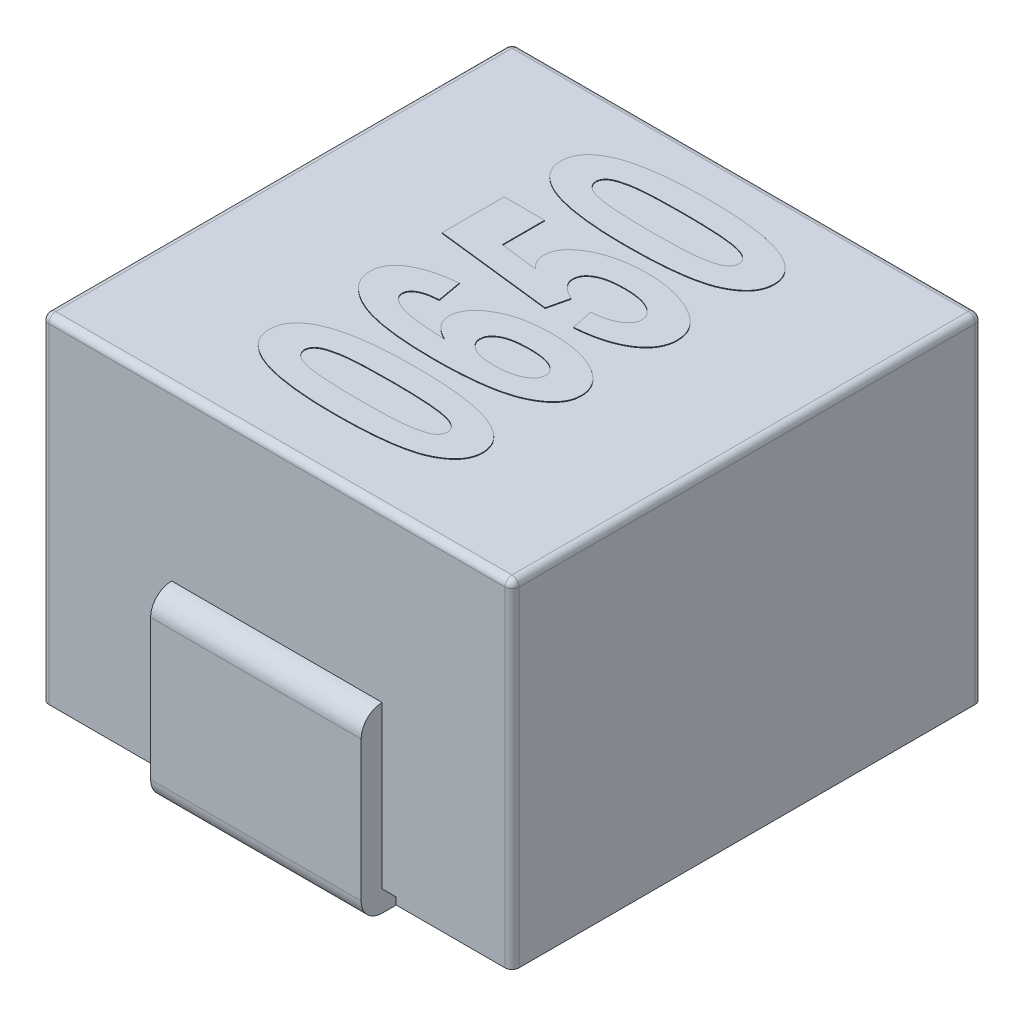
from build123d import *

# Parameters (mm, degrees)
EXTRUDE_1_DEPTH     = 4.8
SKETCH_2_W          = 3.4
SKETCH_2_H          = 2
CUT_EXTRUDE_1_DEPTH = 0.1
EXTRUDE_START       = -1.5
EXTRUDE_1_2_DEPTH   = 3
EXTRUDE_2_DEPTH     = 3
FILLET_1_R          = 0.1
EXTRUDE_2_2_DEPTH   = 0.01


# Read off the part's stored shape, not the designer's step: Вытянуть-Тонкостенный1, Вытянуть-Тонкостенный2
with BuildPart() as part:
    # Эскиз1 → Extrude 1 (new body)
    with BuildSketch(Plane(origin=(0, 0, 0), x_dir=(1, 0, 0), z_dir=(0, 1, 0))):
        with BuildLine():
            Line((-3.25, -3.35), (3.25, -3.35))
            ThreePointArc((3.25, -3.35), (3.320710678, -3.320710678), (3.35, -3.25))
            Line((3.35, -3.25), (3.35, 3.25))
            ThreePointArc((3.35, 3.25), (3.320710678, 3.320710678), (3.25, 3.35))
            Line((3.25, 3.35), (-3.25, 3.35))
            ThreePointArc((-3.25, 3.35), (-3.320710678, 3.320710678), (-3.35, 3.25))
            Line((-3.35, 3.25), (-3.35, -3.25))
            ThreePointArc((-3.35, -3.25), (-3.320710678, -3.320710678), (-3.25, -3.35))
        make_face()
    extrude(amount=EXTRUDE_1_DEPTH)

    # Эскиз2 → Вырез-Вытянуть1 (cut)
    with BuildSketch(Plane.XZ):
        with Locations((0, 2.35)):
            Rectangle(SKETCH_2_W, SKETCH_2_H)
        with Locations((0, -2.35)):
            Rectangle(SKETCH_2_W, SKETCH_2_H)
    extrude(amount=-CUT_EXTRUDE_1_DEPTH, mode=Mode.SUBTRACT)

    # Extrude 1 2 outline → Extrude 1 2 (add)
    with BuildSketch(Plane(origin=(0, 0, 0), x_dir=(0, 0, -1), z_dir=(1, 0, 0)).offset(EXTRUDE_START)):
        with BuildLine():
            Line((-3.35, -0.2), (-1.85, -0.2))
            Line((-1.85, -0.2), (-1.85, 0.1))
            Line((-1.85, 0.1), (-3.35, 0.1))
            Line((-3.35, 0.1), (-3.35, 2.4))
            ThreePointArc((-3.35, 2.4), (-3.562132034, 2.312132034), (-3.65, 2.1))
            Line((-3.65, 2.1), (-3.65, 0.1))
            ThreePointArc((-3.65, 0.1), (-3.562132034, -0.112132034), (-3.35, -0.2))
        make_face()
    extrude(amount=EXTRUDE_1_2_DEPTH)

    # Extrude 2 outline → Extrude 2 (add)
    with BuildSketch(Plane(origin=(0, 0, 0), x_dir=(0, 0, -1), z_dir=(1, 0, 0)).offset(EXTRUDE_START)):
        with BuildLine():
            Line((1.85, 0.1), (1.85, -0.2))
            Line((1.85, -0.2), (3.35, -0.2))
            ThreePointArc((3.35, -0.2), (3.562132034, -0.112132034), (3.65, 0.1))
            Line((3.65, 0.1), (3.65, 2.1))
            ThreePointArc((3.65, 2.1), (3.562132034, 2.312132034), (3.35, 2.4))
            Line((3.35, 2.4), (3.35, 0.1))
            Line((3.35, 0.1), (1.85, 0.1))
        make_face()
    extrude(amount=EXTRUDE_2_DEPTH)

    # Скругление1
    fillet_1_edges = [part.edges().sort_by_distance(p)[0] for p in [
        (3.320710678, 4.8, 3.320710678),
        (3.35, 4.8, 0),
        (3.320710678, 4.8, -3.320710678),
        (0, 4.8, -3.35),
        (-3.320710678, 4.8, -3.320710678),
        (-3.35, 4.8, 0),
        (-3.320710678, 4.8, 3.320710678),
        (0, 4.8, 3.35),
    ]]
    fillet(fillet_1_edges, radius=FILLET_1_R)

    # Эскиз4 → Extrude 2 2 (add)
    # profile 1 of 4: a face of its own
    with BuildSketch(Plane(origin=(0, 4.8, 0), x_dir=(1, 0, 0), z_dir=(0, 1, 0))):
        with BuildLine():
            add(Edge.make_bspline(
                [(-1.5, -1.957692308), (-1.499137143, -1.936566876), (-1.497447551, -1.895200382), (-1.482242122, -1.835098379), (-1.458087806, -1.778584119), (-1.423755807, -1.725761979), (-1.379856182, -1.676448664), (-1.325522016, -1.631842814), (-1.26298141, -1.589080556), (-1.216074382, -1.565892222), (-1.191706731, -1.553846154)],
                knots=[0, 0, 0, 0, 0.939629869, 1.83992419, 2.743264454, 3.666481804, 4.633505536, 5.672028627, 6.790646185, 8, 8, 8, 8], degree=3))
            add(Edge.make_bspline(
                [(-1.191706731, -1.553846154), (-1.158904384, -1.53955104), (-1.089763949, -1.509419953), (-0.974752135, -1.475847916), (-0.845845006, -1.445625948), (-0.701374134, -1.422391671), (-0.542246126, -1.402919805), (-0.367938846, -1.39061196), (-0.178780437, -1.381621929), (-0.047688732, -1.381060813), (0.020432692, -1.380769231)],
                knots=[0, 0, 0, 0, 0.695993191, 1.467006985, 2.327867947, 3.272915826, 4.313905632, 5.448135814, 6.673931191, 8, 8, 8, 8], degree=3))
            add(Edge.make_bspline(
                [(0.020432692, -1.380769231), (0.088346822, -1.38142732), (0.219213706, -1.382695421), (0.408266166, -1.390058637), (0.582217851, -1.404033081), (0.741553906, -1.421993189), (0.886013143, -1.446535154), (1.015745714, -1.476191084), (1.131109184, -1.510782717), (1.200752724, -1.540810484), (1.233774038, -1.555048077)],
                knots=[0, 0, 0, 0, 1.320779415, 2.545071084, 3.678366063, 4.713891943, 5.66240021, 6.526117529, 7.301162213, 8, 8, 8, 8], degree=3))
            add(Edge.make_bspline(
                [(1.233774038, -1.555048077), (1.257897503, -1.567159433), (1.304232457, -1.590422224), (1.366586207, -1.632149894), (1.419375705, -1.677271606), (1.462958308, -1.725975571), (1.497291664, -1.778447599), (1.520545201, -1.835248332), (1.53595582, -1.895181056), (1.537614479, -1.936560343), (1.538461538, -1.957692308)],
                knots=[0, 0, 0, 0, 1.209008214, 2.322193053, 3.353572777, 4.313995313, 5.243012364, 6.148517307, 7.054467326, 8, 8, 8, 8], degree=3))
            add(Edge.make_bspline(
                [(1.538461538, -1.957692308), (1.537411817, -1.978827802), (1.535332896, -2.02068559), (1.518925325, -2.081659932), (1.492824036, -2.139688165), (1.455493603, -2.194066787), (1.407742305, -2.245076498), (1.349426407, -2.292430364), (1.280976264, -2.336770497), (1.20193948, -2.378856542), (1.109155229, -2.416617895), (1.000326036, -2.447366483), (0.875989924, -2.475078094), (0.73501802, -2.496736352), (0.57803189, -2.514064356), (0.404573204, -2.525324635), (0.215024127, -2.533630888), (0.083143563, -2.534278123), (0.014423077, -2.534615385)],
                knots=[0, 0, 0, 0, 0.570946305, 1.130730606, 1.695682016, 2.284720325, 2.905752519, 3.57931678, 4.311109974, 5.108472247, 5.997836566, 7.014420583, 8.163245194, 9.441390503, 10.869501499, 12.433562194, 14.141596213, 16, 16, 16, 16], degree=3))
            add(Edge.make_bspline(
                [(0.014423077, -2.534615385), (-0.053091481, -2.533963284), (-0.183359594, -2.532705068), (-0.371596935, -2.525242226), (-0.545219308, -2.51161966), (-0.703981404, -2.492416926), (-0.848231491, -2.469095664), (-0.97745489, -2.439051032), (-1.092651154, -2.404620183), (-1.162292314, -2.374580012), (-1.1953125, -2.360336538)],
                knots=[0, 0, 0, 0, 1.316839064, 2.540817049, 3.673540427, 4.712565747, 5.659351526, 6.521795573, 7.299112968, 8, 8, 8, 8], degree=3))
            add(Edge.make_bspline(
                [(-1.1953125, -2.360336538), (-1.219440057, -2.348228581), (-1.265782873, -2.324972317), (-1.32808256, -2.283199756), (-1.381170251, -2.238132726), (-1.424095116, -2.188901849), (-1.459027623, -2.136872971), (-1.482048346, -2.080111905), (-1.497503564, -2.020209967), (-1.499156079, -1.978826439), (-1.5, -1.957692308)],
                knots=[0, 0, 0, 0, 1.209129629, 2.322426261, 3.353909562, 4.321163245, 5.242735491, 6.14833137, 7.05437237, 8, 8, 8, 8], degree=3))
        make_face()
        with BuildLine():
            add(Edge.make_bspline(
                [(-1, -1.957692308), (-0.999127679, -1.968216797), (-0.997360051, -1.989543107), (-0.98464763, -2.020189646), (-0.963752812, -2.048548502), (-0.934793713, -2.075564705), (-0.894910908, -2.09990752), (-0.842840464, -2.120448699), (-0.778433667, -2.137921563), (-0.731044768, -2.146944568), (-0.705528846, -2.151802885)],
                knots=[0, 0, 0, 0, 0.66053735, 1.338480494, 2.051183008, 2.861689582, 3.811811342, 4.969049189, 6.368024884, 8, 8, 8, 8], degree=3))
            add(Edge.make_bspline(
                [(-0.705528846, -2.151802885), (-0.686111734, -2.154704884), (-0.644159002, -2.160974962), (-0.576454743, -2.168853117), (-0.499229717, -2.1742951), (-0.413125803, -2.180127901), (-0.317716076, -2.183163637), (-0.213360006, -2.186421571), (-0.099564736, -2.188131724), (-0.020633397, -2.188348668), (0.020432692, -2.188461538)],
                knots=[0, 0, 0, 0, 0.647628605, 1.399270384, 2.247685976, 3.201110699, 4.24594481, 5.39623077, 6.6453211, 8, 8, 8, 8], degree=3))
            add(Edge.make_bspline(
                [(0.020432692, -2.188461538), (0.061297689, -2.188275136), (0.13962396, -2.187917856), (0.252024839, -2.187185067), (0.354384455, -2.183885271), (0.446927652, -2.18023517), (0.529543314, -2.176665945), (0.602017058, -2.17022466), (0.664624604, -2.164110466), (0.732465088, -2.153898049), (0.803572683, -2.140125262), (0.875380999, -2.120604957), (0.93178471, -2.099804879), (0.973513657, -2.07550215), (1.002243275, -2.048087616), (1.023951014, -2.020532594), (1.035633028, -1.989383166), (1.037524767, -1.968187963), (1.038461538, -1.957692308)],
                knots=[0, 0, 0, 0, 1.772229522, 3.396846643, 4.874325468, 6.213183949, 7.413572011, 8.459660885, 9.368179202, 10.14095794, 11.434081607, 12.506883432, 13.365124891, 14.035567992, 14.582591736, 15.079517174, 15.544185971, 16, 16, 16, 16], degree=3))
            add(Edge.make_bspline(
                [(1.038461538, -1.957692308), (1.037650183, -1.946944638), (1.036035603, -1.925557014), (1.022740293, -1.895014588), (1.002646122, -1.866265058), (0.972969063, -1.83991199), (0.933432472, -1.815419158), (0.881280735, -1.794956445), (0.816902053, -1.777456443), (0.769508703, -1.768437735), (0.743990385, -1.763581731)],
                knots=[0, 0, 0, 0, 0.672803919, 1.338864841, 2.061605897, 2.863308736, 3.813131099, 4.970004284, 6.368539142, 8, 8, 8, 8], degree=3))
            add(Edge.make_bspline(
                [(0.743990385, -1.763581731), (0.724572687, -1.760684675), (0.682815507, -1.754454644), (0.615519911, -1.746519364), (0.538893118, -1.741091016), (0.453191294, -1.735236285), (0.357980214, -1.732225337), (0.253624515, -1.728961702), (0.140029441, -1.727256369), (0.061298449, -1.727036962), (0.020432692, -1.726923077)],
                knots=[0, 0, 0, 0, 0.649769229, 1.397309303, 2.24191953, 3.191878681, 4.240166309, 5.394254338, 6.647473319, 8, 8, 8, 8], degree=3))
            add(Edge.make_bspline(
                [(0.020432692, -1.726923077), (-0.020432322, -1.727108707), (-0.098758626, -1.727464505), (-0.211359517, -1.728208719), (-0.313919908, -1.731488821), (-0.40666384, -1.735142837), (-0.489476366, -1.73875147), (-0.562156311, -1.745124382), (-0.62496015, -1.751282622), (-0.692610398, -1.761433922), (-0.763505543, -1.775316331), (-0.835258867, -1.79490132), (-0.892136546, -1.815562221), (-0.934274946, -1.839978234), (-0.963909922, -1.866874521), (-0.98462943, -1.895212168), (-0.997364372, -1.925837425), (-0.999129107, -1.947166469), (-1, -1.957692308)],
                knots=[0, 0, 0, 0, 1.769047239, 3.390747135, 4.874240912, 6.210695287, 7.408927887, 8.461780351, 9.368667298, 10.140058405, 11.422355672, 12.493231132, 13.358012728, 14.034682899, 14.587091034, 15.078019327, 15.545004449, 16, 16, 16, 16], degree=3))
        make_face(mode=Mode.SUBTRACT)
    # profile 2 of 4: a face of its own
    with BuildSketch(Plane(origin=(0, 4.8, 0), x_dir=(1, 0, 0), z_dir=(0, 1, 0))):
        with BuildLine():
            Line((-0.716947115, -0.034615385), (-0.653846154, -0.380769231))
            add(Edge.make_bspline(
                [(-0.653846154, -0.380769231), (-0.681547205, -0.382889175), (-0.733200789, -0.386842193), (-0.804831062, -0.399473341), (-0.865288637, -0.416090973), (-0.914169487, -0.438291327), (-0.952438737, -0.464341137), (-0.979725566, -0.494738618), (-0.996995203, -0.529605986), (-0.99898864, -0.554458508), (-1, -0.567067308)],
                knots=[0, 0, 0, 0, 1.549919711, 2.8901037, 4.054353795, 5.039938989, 5.874463713, 6.61920834, 7.299462416, 8, 8, 8, 8], degree=3))
            add(Edge.make_bspline(
                [(-1, -0.567067308), (-0.999654476, -0.575566657), (-0.99896188, -0.592603468), (-0.98950017, -0.617077399), (-0.976354433, -0.640877904), (-0.957197105, -0.663312067), (-0.932677568, -0.684107646), (-0.903627614, -0.704983619), (-0.868638664, -0.723635404), (-0.827958571, -0.742415177), (-0.778668125, -0.759259885), (-0.719275561, -0.774771817), (-0.648460203, -0.787425798), (-0.566873386, -0.799268821), (-0.474338721, -0.810310047), (-0.370650905, -0.818109574), (-0.255880051, -0.825624574), (-0.17549124, -0.828686016), (-0.133413462, -0.830288462)],
                knots=[0, 0, 0, 0, 0.421598826, 0.845088239, 1.292540369, 1.774895999, 2.30602329, 2.893820393, 3.555766604, 4.280231038, 5.127209864, 6.150050241, 7.339703188, 8.713347625, 10.262722907, 11.9871774, 13.89957508, 16, 16, 16, 16], degree=3))
            add(Edge.make_bspline(
                [(-0.133413462, -0.830288462), (-0.153226041, -0.819580375), (-0.19108179, -0.799120512), (-0.242718247, -0.764788806), (-0.286608857, -0.728348218), (-0.321502927, -0.688749083), (-0.350077859, -0.648240126), (-0.370205963, -0.605180581), (-0.381933675, -0.559868017), (-0.383717932, -0.529071749), (-0.384615385, -0.513581731)],
                knots=[0, 0, 0, 0, 1.267157945, 2.421149296, 3.485202224, 4.467489562, 5.383884497, 6.266713326, 7.128185226, 8, 8, 8, 8], degree=3))
            add(Edge.make_bspline(
                [(-0.384615385, -0.513581731), (-0.383753764, -0.496092925), (-0.382039735, -0.461302267), (-0.369774534, -0.40992183), (-0.348123112, -0.360966415), (-0.319073969, -0.313802855), (-0.28172485, -0.268656146), (-0.23557482, -0.226326612), (-0.181677232, -0.185291033), (-0.12020114, -0.146556207), (-0.052015436, -0.111758018), (0.020926011, -0.079830438), (0.099461039, -0.054651517), (0.182180379, -0.032638342), (0.270071765, -0.016824283), (0.362307799, -0.004782102), (0.459617513, 0.002554479), (0.526028935, 0.003408212), (0.560096154, 0.003846154)],
                knots=[0, 0, 0, 0, 0.712118958, 1.416625472, 2.136553801, 2.883795801, 3.66624321, 4.51480892, 5.428643096, 6.422356621, 7.469656695, 8.544188354, 9.661363121, 10.824973369, 12.028350145, 13.295373735, 14.612601657, 16, 16, 16, 16], degree=3))
            add(Edge.make_bspline(
                [(0.560096154, 0.003846154), (0.596168309, 0.003421893), (0.666384952, 0.002596043), (0.769063955, -0.004896221), (0.866298056, -0.016328939), (0.957852718, -0.034227442), (1.044263907, -0.05525344), (1.124753742, -0.082731392), (1.200519276, -0.113530758), (1.26974538, -0.150376182), (1.332843965, -0.189815334), (1.38725083, -0.23361695), (1.434194106, -0.279210116), (1.472474655, -0.328003059), (1.501748007, -0.38000015), (1.523067826, -0.434539702), (1.53609788, -0.492139584), (1.537668448, -0.531544161), (1.538461538, -0.551442308)],
                knots=[0, 0, 0, 0, 1.39498986, 2.71543254, 3.980142828, 5.179086445, 6.321625476, 7.416841902, 8.465806243, 9.481271331, 10.446328925, 11.339337795, 12.177594524, 12.972664813, 13.729001214, 14.477197864, 15.231029898, 16, 16, 16, 16], degree=3))
            add(Edge.make_bspline(
                [(1.538461538, -0.551442308), (1.537427146, -0.572777842), (1.535366803, -0.615274755), (1.518481686, -0.677481166), (1.490480293, -0.736422249), (1.45069746, -0.791763062), (1.401339194, -0.844850442), (1.340291423, -0.894127013), (1.268586086, -0.940394461), (1.186011794, -0.984335233), (1.090810257, -1.024609906), (0.981459802, -1.05696177), (0.859116341, -1.087065691), (0.722201649, -1.109467722), (0.571499521, -1.128453191), (0.406581412, -1.139980044), (0.228067882, -1.149182415), (0.104381233, -1.149720874), (0.040264423, -1.15)],
                knots=[0, 0, 0, 0, 0.582864578, 1.16097142, 1.749167969, 2.358718482, 3.017750106, 3.726302687, 4.498298734, 5.348834351, 6.281956375, 7.320036994, 8.464218828, 9.726176242, 11.111856478, 12.61750766, 14.246580185, 16, 16, 16, 16], degree=3))
            add(Edge.make_bspline(
                [(0.040264423, -1.15), (-0.025447276, -1.149345796), (-0.152311215, -1.148082781), (-0.335546367, -1.140643622), (-0.504560877, -1.126987543), (-0.659125219, -1.10779629), (-0.799750296, -1.084409689), (-0.926046606, -1.054514414), (-1.038405685, -1.019590677), (-1.136586221, -0.978467516), (-1.221972319, -0.933227902), (-1.296065858, -0.884767436), (-1.358167243, -0.832084508), (-1.410522361, -0.777569442), (-1.450234722, -0.718215697), (-1.478642787, -0.655712732), (-1.497291946, -0.589966759), (-1.49909323, -0.544754917), (-1.5, -0.521995192)],
                knots=[0, 0, 0, 0, 1.739098909, 3.357529062, 4.85223663, 6.225247106, 7.478570524, 8.623010299, 9.657512328, 10.588950926, 11.435634555, 12.211994303, 12.92677536, 13.586936376, 14.20596628, 14.806185805, 15.399031722, 16, 16, 16, 16], degree=3))
            add(Edge.make_bspline(
                [(-1.5, -0.521995192), (-1.499509835, -0.505912065), (-1.498544734, -0.474245452), (-1.48823713, -0.428027115), (-1.472908661, -0.383689243), (-1.45008245, -0.342235737), (-1.422204146, -0.30221565), (-1.386808754, -0.265294978), (-1.345917612, -0.229675703), (-1.298656162, -0.196710911), (-1.245690419, -0.165926024), (-1.186493628, -0.138726176), (-1.122305644, -0.113139062), (-1.051964992, -0.091975207), (-0.976507625, -0.072427191), (-0.894885635, -0.057345975), (-0.807953117, -0.043816558), (-0.74783237, -0.037738042), (-0.716947115, -0.034615385)],
                knots=[0, 0, 0, 0, 0.76381956, 1.50391014, 2.242342492, 2.988420858, 3.747230929, 4.55625529, 5.414143539, 6.323616016, 7.292829522, 8.324445395, 9.419800476, 10.577190305, 11.815979938, 13.12605627, 14.523596504, 16, 16, 16, 16], degree=3))
        make_face()
        with BuildLine():
            add(Edge.make_bspline(
                [(0.546875, -0.803846154), (0.583979099, -0.802982954), (0.653869542, -0.801357004), (0.752205069, -0.787904535), (0.837302066, -0.764872177), (0.908736182, -0.732952461), (0.964873214, -0.693863458), (1.006703356, -0.652463235), (1.033893336, -0.606715693), (1.036965076, -0.573993964), (1.038461538, -0.558052885)],
                knots=[0, 0, 0, 0, 1.487550157, 2.801996091, 3.96948146, 5.011955507, 5.923443518, 6.696061968, 7.364759143, 8, 8, 8, 8], degree=3))
            add(Edge.make_bspline(
                [(1.038461538, -0.558052885), (1.037247589, -0.542975729), (1.034821752, -0.512847031), (1.01275913, -0.470990618), (0.979139196, -0.433336895), (0.940843155, -0.407605158), (0.904366542, -0.388787238), (0.871658869, -0.37638195), (0.834963082, -0.36540953), (0.793808605, -0.357538593), (0.748802939, -0.349978418), (0.699405743, -0.345359083), (0.645851915, -0.343266067), (0.608775561, -0.342635026), (0.589543269, -0.342307692)],
                knots=[0, 0, 0, 0, 0.98415851, 1.96664515, 3.038345339, 4.2755351, 4.969759699, 5.731949388, 6.568604871, 7.481899529, 8.481065577, 9.564888458, 10.736856013, 12, 12, 12, 12], degree=3))
            add(Edge.make_bspline(
                [(0.589543269, -0.342307692), (0.569708839, -0.342582964), (0.531418978, -0.343114368), (0.476051528, -0.345911797), (0.424928736, -0.351378852), (0.377810294, -0.358615233), (0.33470023, -0.367193062), (0.295721336, -0.378754893), (0.260906126, -0.392429778), (0.221493613, -0.412585751), (0.180059321, -0.440438597), (0.143547098, -0.480900385), (0.119316595, -0.526029455), (0.11669742, -0.558569706), (0.115384615, -0.574879808)],
                knots=[0, 0, 0, 0, 1.22920971, 2.372957979, 3.434023047, 4.413685549, 5.326664308, 6.15541423, 6.929955182, 7.640580054, 8.897558011, 9.996505919, 10.995791649, 12, 12, 12, 12], degree=3))
            add(Edge.make_bspline(
                [(0.115384615, -0.574879808), (0.116603075, -0.590534425), (0.119054708, -0.622032703), (0.141364485, -0.666457866), (0.177501245, -0.705244394), (0.225416305, -0.741153975), (0.287618906, -0.769565278), (0.36277845, -0.789326477), (0.45050488, -0.801900588), (0.513373049, -0.803169801), (0.546875, -0.803846154)],
                knots=[0, 0, 0, 0, 0.695405127, 1.39920786, 2.165432477, 3.046964329, 4.054821068, 5.195738149, 6.505630974, 8, 8, 8, 8], degree=3))
        make_face(mode=Mode.SUBTRACT)
    # profile 3 of 4: a face of its own
    with BuildSketch(Plane(origin=(0, 4.8, 0), x_dir=(1, 0, 0), z_dir=(0, 1, 0))):
        with BuildLine():
            Line((0.641826923, 0.234615385), (0.576923077, 0.542307692))
            add(Edge.make_bspline(
                [(0.576923077, 0.542307692), (0.610679394, 0.545395742), (0.674863039, 0.551267302), (0.765048627, 0.570798355), (0.844765049, 0.596638159), (0.912482008, 0.630670904), (0.967759927, 0.669376552), (1.007474305, 0.71282158), (1.033951318, 0.759622982), (1.036973234, 0.793199184), (1.038461538, 0.809735577)],
                knots=[0, 0, 0, 0, 1.407758696, 2.676686699, 3.827332599, 4.881144903, 5.817156249, 6.613060699, 7.316927734, 8, 8, 8, 8], degree=3))
            add(Edge.make_bspline(
                [(1.038461538, 0.809735577), (1.03701813, 0.828239954), (1.034113826, 0.865472908), (1.007797585, 0.917927274), (0.965611214, 0.964385536), (0.919202884, 0.99748608), (0.875371888, 1.021718692), (0.836823543, 1.037027548), (0.794860492, 1.051227915), (0.748214474, 1.061434361), (0.697795583, 1.070866922), (0.643127829, 1.076400905), (0.584589434, 1.080166224), (0.544277867, 1.080563728), (0.5234375, 1.080769231)],
                knots=[0, 0, 0, 0, 1.034051611, 2.080631741, 3.220339062, 4.532041754, 5.261927545, 6.028594457, 6.857440335, 7.746965165, 8.706828443, 9.736649533, 10.829887843, 12, 12, 12, 12], degree=3))
            add(Edge.make_bspline(
                [(0.5234375, 1.080769231), (0.503806022, 1.080473621), (0.465921619, 1.079903161), (0.410698234, 1.077361076), (0.35968697, 1.070840856), (0.311940568, 1.064236453), (0.268488838, 1.053787426), (0.228396223, 1.041970346), (0.192127458, 1.027576053), (0.150549586, 1.005975644), (0.106731596, 0.975441555), (0.066996965, 0.93146213), (0.043018811, 0.880386556), (0.03999119, 0.844229336), (0.038461538, 0.825961538)],
                knots=[0, 0, 0, 0, 1.16702076, 2.252091488, 3.282897335, 4.222483009, 5.114869428, 5.935944765, 6.70532731, 7.429534691, 8.718069503, 9.857122197, 10.917348753, 12, 12, 12, 12], degree=3))
            add(Edge.make_bspline(
                [(0.038461538, 0.825961538), (0.039148005, 0.814255798), (0.040526969, 0.790741483), (0.052220978, 0.756269412), (0.070655893, 0.722850357), (0.096277778, 0.690268986), (0.129196568, 0.658944837), (0.16941944, 0.629018749), (0.216458717, 0.599493118), (0.25105281, 0.581703551), (0.269230769, 0.572355769)],
                knots=[0, 0, 0, 0, 0.777365265, 1.56155964, 2.396788521, 3.308817419, 4.308250754, 5.412128752, 6.64016616, 8, 8, 8, 8], degree=3))
            Line((0.269230769, 0.572355769), (0.198317308, 0.273076923))
            Line((0.198317308, 0.273076923), (-1.461538462, 0.465384615))
            Line((-1.461538462, 0.465384615), (-1.461538462, 1.35))
            Line((-1.461538462, 1.35), (-0.884615385, 1.35))
            Line((-0.884615385, 1.35), (-0.884615385, 0.747836538))
            Line((-0.884615385, 0.747836538), (-0.352764423, 0.683533654))
            add(Edge.make_bspline(
                [(-0.352764423, 0.683533654), (-0.369201237, 0.701481545), (-0.400307681, 0.735447683), (-0.435531258, 0.791636948), (-0.457574653, 0.84901102), (-0.460241487, 0.888087229), (-0.461538462, 0.907091346)],
                knots=[0, 0, 0, 0, 1.143752909, 2.164536708, 3.107350463, 4, 4, 4, 4], degree=3))
            add(Edge.make_bspline(
                [(-0.461538462, 0.907091346), (-0.460762526, 0.925001519), (-0.459225596, 0.96047697), (-0.445825336, 1.012393465), (-0.424838269, 1.062346988), (-0.393875488, 1.109353824), (-0.355643312, 1.154814574), (-0.308951752, 1.198342706), (-0.253317582, 1.238801088), (-0.190179224, 1.277131439), (-0.120530613, 1.312303372), (-0.044997174, 1.342686753), (0.035082736, 1.369631171), (0.120701488, 1.389961638), (0.211042676, 1.407338047), (0.306694886, 1.41801537), (0.407126621, 1.425690541), (0.475745157, 1.426506186), (0.510817308, 1.426923077)],
                knots=[0, 0, 0, 0, 0.711725397, 1.409745146, 2.120532269, 2.859164334, 3.640042284, 4.480467279, 5.392520005, 6.372852863, 7.417497191, 8.493786399, 9.610619135, 10.77656542, 11.993065377, 13.269678342, 14.604484161, 16, 16, 16, 16], degree=3))
            add(Edge.make_bspline(
                [(0.510817308, 1.426923077), (0.540475399, 1.426633788), (0.598853702, 1.42606436), (0.685303427, 1.419843173), (0.769126969, 1.409704625), (0.85069766, 1.395651609), (0.930007261, 1.378855034), (1.006556621, 1.355922985), (1.081010361, 1.330676104), (1.128922987, 1.310238649), (1.152644231, 1.300120192)],
                knots=[0, 0, 0, 0, 1.079805715, 2.125464639, 3.154194097, 4.153139282, 5.13897498, 6.103889648, 7.061247531, 8, 8, 8, 8], degree=3))
            add(Edge.make_bspline(
                [(1.152644231, 1.300120192), (1.183030338, 1.285730602), (1.241515152, 1.258034639), (1.320233673, 1.208056012), (1.387651548, 1.1542622), (1.442812912, 1.095998712), (1.485885958, 1.03319067), (1.516452973, 0.965946373), (1.535100219, 0.894269651), (1.53733309, 0.844901571), (1.538461538, 0.819951923)],
                knots=[0, 0, 0, 0, 1.232211664, 2.37166512, 3.411302611, 4.388546507, 5.303567267, 6.191367956, 7.085953247, 8, 8, 8, 8], degree=3))
            add(Edge.make_bspline(
                [(1.538461538, 0.819951923), (1.537845242, 0.79986207), (1.536632942, 0.760343831), (1.524701496, 0.702480641), (1.505526766, 0.647679478), (1.478567999, 0.595712926), (1.443841025, 0.546758582), (1.401732873, 0.50046798), (1.351584161, 0.457563989), (1.294766949, 0.417651745), (1.231481929, 0.38116874), (1.162872592, 0.348015456), (1.088691123, 0.319209261), (1.00923826, 0.294864578), (0.9247861, 0.273800097), (0.835153643, 0.256344782), (0.740227248, 0.24326803), (0.675108992, 0.23754198), (0.641826923, 0.234615385)],
                knots=[0, 0, 0, 0, 0.818746466, 1.610535326, 2.398900263, 3.181141225, 3.990616551, 4.841094953, 5.727567066, 6.67764902, 7.670093515, 8.704554039, 9.78363785, 10.913284538, 12.092685878, 13.333278512, 14.637033372, 16, 16, 16, 16], degree=3))
        make_face()
    # profile 4 of 4: a face of its own
    with BuildSketch(Plane(origin=(0, 4.8, 0), x_dir=(1, 0, 0), z_dir=(0, 1, 0))):
        with BuildLine():
            add(Edge.make_bspline(
                [(-1.5, 2.196153846), (-1.499137143, 2.217279278), (-1.497447551, 2.258645772), (-1.482242122, 2.318747775), (-1.458087806, 2.375262035), (-1.423755807, 2.428084175), (-1.379856182, 2.47739749), (-1.325522016, 2.52200334), (-1.26298141, 2.564765598), (-1.216074382, 2.587953932), (-1.191706731, 2.6)],
                knots=[0, 0, 0, 0, 0.939629869, 1.83992419, 2.743264454, 3.666481804, 4.633505536, 5.672028627, 6.790646185, 8, 8, 8, 8], degree=3))
            add(Edge.make_bspline(
                [(-1.191706731, 2.6), (-1.158904384, 2.614295114), (-1.089763949, 2.644426201), (-0.974752135, 2.677998238), (-0.845845006, 2.708220205), (-0.701374134, 2.731454483), (-0.542246126, 2.750926349), (-0.367938846, 2.763234194), (-0.178780437, 2.772224225), (-0.047688732, 2.772785341), (0.020432692, 2.773076923)],
                knots=[0, 0, 0, 0, 0.695993191, 1.467006985, 2.327867947, 3.272915826, 4.313905632, 5.448135814, 6.673931191, 8, 8, 8, 8], degree=3))
            add(Edge.make_bspline(
                [(0.020432692, 2.773076923), (0.088346822, 2.772418834), (0.219213706, 2.771150733), (0.408266166, 2.763787517), (0.582217851, 2.749813073), (0.741553906, 2.731852965), (0.886013143, 2.707311), (1.015745714, 2.67765507), (1.131109184, 2.643063437), (1.200752724, 2.61303567), (1.233774038, 2.598798077)],
                knots=[0, 0, 0, 0, 1.320779415, 2.545071084, 3.678366063, 4.713891943, 5.66240021, 6.526117529, 7.301162213, 8, 8, 8, 8], degree=3))
            add(Edge.make_bspline(
                [(1.233774038, 2.598798077), (1.257897503, 2.586686721), (1.304232457, 2.56342393), (1.366586207, 2.52169626), (1.419375705, 2.476574548), (1.462958308, 2.427870583), (1.497291664, 2.375398555), (1.520545201, 2.318597822), (1.53595582, 2.258665098), (1.537614479, 2.217285811), (1.538461538, 2.196153846)],
                knots=[0, 0, 0, 0, 1.209008214, 2.322193053, 3.353572777, 4.313995313, 5.243012364, 6.148517307, 7.054467326, 8, 8, 8, 8], degree=3))
            add(Edge.make_bspline(
                [(1.538461538, 2.196153846), (1.537411817, 2.175018352), (1.535332896, 2.133160563), (1.518925325, 2.072186222), (1.492824036, 2.014157989), (1.455493603, 1.959779367), (1.407742305, 1.908769656), (1.349426407, 1.86141579), (1.280976264, 1.817075657), (1.20193948, 1.774989612), (1.109155229, 1.737228259), (1.000326036, 1.706479671), (0.875989924, 1.67876806), (0.73501802, 1.657109802), (0.57803189, 1.639781798), (0.404573204, 1.628521519), (0.215024127, 1.620215266), (0.083143563, 1.619568031), (0.014423077, 1.619230769)],
                knots=[0, 0, 0, 0, 0.570946305, 1.130730606, 1.695682016, 2.284720325, 2.905752519, 3.57931678, 4.311109974, 5.108472247, 5.997836566, 7.014420583, 8.163245194, 9.441390503, 10.869501499, 12.433562194, 14.141596213, 16, 16, 16, 16], degree=3))
            add(Edge.make_bspline(
                [(0.014423077, 1.619230769), (-0.053091481, 1.61988287), (-0.183359594, 1.621141086), (-0.371596935, 1.628603928), (-0.545219308, 1.642226494), (-0.703981404, 1.661429228), (-0.848231491, 1.68475049), (-0.97745489, 1.714795122), (-1.092651154, 1.749225971), (-1.162292314, 1.779266142), (-1.1953125, 1.793509615)],
                knots=[0, 0, 0, 0, 1.316839064, 2.540817049, 3.673540427, 4.712565747, 5.659351526, 6.521795573, 7.299112968, 8, 8, 8, 8], degree=3))
            add(Edge.make_bspline(
                [(-1.1953125, 1.793509615), (-1.219440057, 1.805617573), (-1.265782873, 1.828873837), (-1.32808256, 1.870646398), (-1.381170251, 1.915713428), (-1.424095116, 1.964944305), (-1.459027623, 2.016973183), (-1.482048346, 2.073734248), (-1.497503564, 2.133636187), (-1.499156079, 2.175019715), (-1.5, 2.196153846)],
                knots=[0, 0, 0, 0, 1.209129629, 2.322426261, 3.353909562, 4.321163245, 5.242735491, 6.14833137, 7.05437237, 8, 8, 8, 8], degree=3))
        make_face()
        with BuildLine():
            add(Edge.make_bspline(
                [(-1, 2.196153846), (-0.999127679, 2.185629357), (-0.997360051, 2.164303047), (-0.98464763, 2.133656508), (-0.963752812, 2.105297652), (-0.934793713, 2.078281449), (-0.894910908, 2.053938634), (-0.842840464, 2.033397455), (-0.778433667, 2.01592459), (-0.731044768, 2.006901586), (-0.705528846, 2.002043269)],
                knots=[0, 0, 0, 0, 0.66053735, 1.338480494, 2.051183008, 2.861689582, 3.811811342, 4.969049189, 6.368024884, 8, 8, 8, 8], degree=3))
            add(Edge.make_bspline(
                [(-0.705528846, 2.002043269), (-0.686111734, 1.99914127), (-0.644159002, 1.992871192), (-0.576454743, 1.984993036), (-0.499229717, 1.979551054), (-0.413125803, 1.973718253), (-0.317716076, 1.970682517), (-0.213360006, 1.967424583), (-0.099564736, 1.96571443), (-0.020633397, 1.965497486), (0.020432692, 1.965384615)],
                knots=[0, 0, 0, 0, 0.647628605, 1.399270384, 2.247685976, 3.201110699, 4.24594481, 5.39623077, 6.6453211, 8, 8, 8, 8], degree=3))
            add(Edge.make_bspline(
                [(0.020432692, 1.965384615), (0.061297689, 1.965571018), (0.13962396, 1.965928298), (0.252024839, 1.966661087), (0.354384455, 1.969960883), (0.446927652, 1.973610983), (0.529543314, 1.977180209), (0.602017058, 1.983621494), (0.664624604, 1.989735688), (0.732465088, 1.999948105), (0.803572683, 2.013720892), (0.875380999, 2.033241197), (0.93178471, 2.054041275), (0.973513657, 2.078344004), (1.002243275, 2.105758538), (1.023951014, 2.133313559), (1.035633028, 2.164462988), (1.037524767, 2.185658191), (1.038461538, 2.196153846)],
                knots=[0, 0, 0, 0, 1.772229522, 3.396846643, 4.874325468, 6.213183949, 7.413572011, 8.459660885, 9.368179202, 10.14095794, 11.434081607, 12.506883432, 13.365124891, 14.035567992, 14.582591736, 15.079517174, 15.544185971, 16, 16, 16, 16], degree=3))
            add(Edge.make_bspline(
                [(1.038461538, 2.196153846), (1.037650183, 2.206901516), (1.036035603, 2.22828914), (1.022740293, 2.258831566), (1.002646122, 2.287581096), (0.972969063, 2.313934164), (0.933432472, 2.338426996), (0.881280735, 2.358889709), (0.816902053, 2.37638971), (0.769508703, 2.385408419), (0.743990385, 2.390264423)],
                knots=[0, 0, 0, 0, 0.672803919, 1.338864841, 2.061605897, 2.863308736, 3.813131099, 4.970004284, 6.368539142, 8, 8, 8, 8], degree=3))
            add(Edge.make_bspline(
                [(0.743990385, 2.390264423), (0.724572687, 2.393161478), (0.682815507, 2.39939151), (0.615519911, 2.407326789), (0.538893118, 2.412755138), (0.453191294, 2.418609869), (0.357980214, 2.421620816), (0.253624515, 2.424884452), (0.140029441, 2.426589785), (0.061298449, 2.426809192), (0.020432692, 2.426923077)],
                knots=[0, 0, 0, 0, 0.649769229, 1.397309303, 2.24191953, 3.191878681, 4.240166309, 5.394254338, 6.647473319, 8, 8, 8, 8], degree=3))
            add(Edge.make_bspline(
                [(0.020432692, 2.426923077), (-0.020432322, 2.426737447), (-0.098758626, 2.426381649), (-0.211359517, 2.425637435), (-0.313919908, 2.422357332), (-0.40666384, 2.418703317), (-0.489476366, 2.415094684), (-0.562156311, 2.408721772), (-0.62496015, 2.402563531), (-0.692610398, 2.392412232), (-0.763505543, 2.378529823), (-0.835258867, 2.358944834), (-0.892136546, 2.338283933), (-0.934274946, 2.313867919), (-0.963909922, 2.286971633), (-0.98462943, 2.258633985), (-0.997364372, 2.228008729), (-0.999129107, 2.206679685), (-1, 2.196153846)],
                knots=[0, 0, 0, 0, 1.769047239, 3.390747135, 4.874240912, 6.210695287, 7.408927887, 8.461780351, 9.368667298, 10.140058405, 11.422355672, 12.493231132, 13.358012728, 14.034682899, 14.587091034, 15.078019327, 15.545004449, 16, 16, 16, 16], degree=3))
        make_face(mode=Mode.SUBTRACT)
    extrude(amount=EXTRUDE_2_2_DEPTH)


solid = part.part
